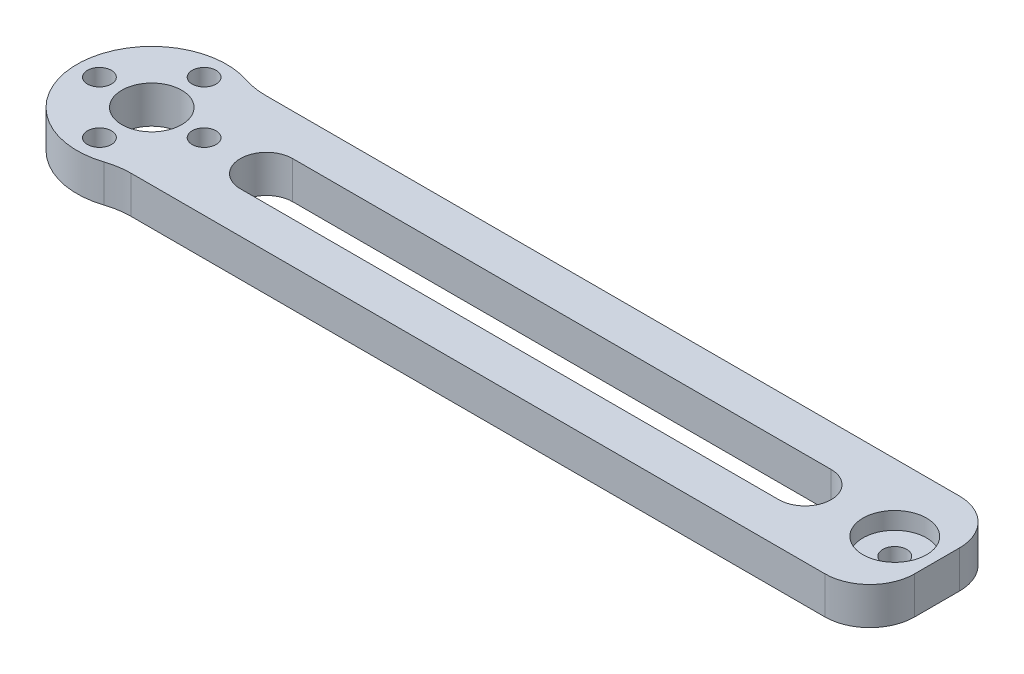
from build123d import *

# Parameters (mm, degrees)
SKETCH_1_R          = 1.6
SKETCH_1_R_2        = 4
EXTRUDE_1_DEPTH     = 5
SKETCH_2_R          = 4.25
CUT_EXTRUDE_1_DEPTH = 2.3
EXTRUDE_START       = -5
SKETCH_3_R          = 10
SKETCH_3_R_2        = 9
EXTRUDE_2_DEPTH     = 5
FILLET_1_R          = 10


with BuildPart() as part:
    # 草图1 → 凸台-拉伸1 (new body)
    with BuildSketch(Plane(origin=(0, 0, 0), x_dir=(1, 0, 0), z_dir=(0, 1, 0))):
        with BuildLine():
            Line((99, 9), (0, 9))
            ThreePointArc((0, 9), (-9, 0), (0, -9))
            Line((0, -9), (99, -9))
            ThreePointArc((99, -9), (103.242640687, -7.242640687), (105, -3))
            Line((105, -3), (105, 3))
            ThreePointArc((105, 3), (103.242640687, 7.242640687), (99, 9))
        make_face()
        with BuildLine():
            ThreePointArc((15.34, -3.5), (11.84, 0), (15.34, 3.5))
            Line((15.34, 3.5), (87.34, 3.5))
            ThreePointArc((87.34, 3.5), (90.84, 0), (87.34, -3.5))
            Line((87.34, -3.5), (15.34, -3.5))
        make_face(mode=Mode.SUBTRACT)
        with Locations((99.34, 0)):
            Circle(SKETCH_1_R, mode=Mode.SUBTRACT)
        with Locations((7, 0)):
            Circle(SKETCH_1_R, mode=Mode.SUBTRACT)
        with Locations((0, 7)):
            Circle(SKETCH_1_R, mode=Mode.SUBTRACT)
        with Locations((0, -7)):
            Circle(SKETCH_1_R, mode=Mode.SUBTRACT)
        with Locations((-7, 0)):
            Circle(SKETCH_1_R, mode=Mode.SUBTRACT)
        Circle(SKETCH_1_R_2, mode=Mode.SUBTRACT)
    extrude(amount=EXTRUDE_1_DEPTH)

    # 草图2 → 切除-拉伸1 (cut)
    with BuildSketch(Plane(origin=(0, 5, 0), x_dir=(1, 0, 0), z_dir=(0, 1, 0))):
        with Locations((99.34, 0)):
            Circle(SKETCH_2_R)
    extrude(amount=-CUT_EXTRUDE_1_DEPTH, mode=Mode.SUBTRACT)

    # 草图3 → 凸台-拉伸2 (add)
    with BuildSketch(Plane(origin=(0, 5, 0), x_dir=(1, 0, 0), z_dir=(0, 1, 0)).offset(EXTRUDE_START)):
        Circle(SKETCH_3_R)
        Circle(SKETCH_3_R_2, mode=Mode.SUBTRACT)
    extrude(amount=EXTRUDE_2_DEPTH)

    # 圆角1
    fillet_1_edges = [part.edges().sort_by_distance(p)[0] for p in [
        (4.358898944, 2.5, 9),
        (4.358898944, 2.5, -9),
    ]]
    fillet(fillet_1_edges, radius=FILLET_1_R)


solid = part.part
